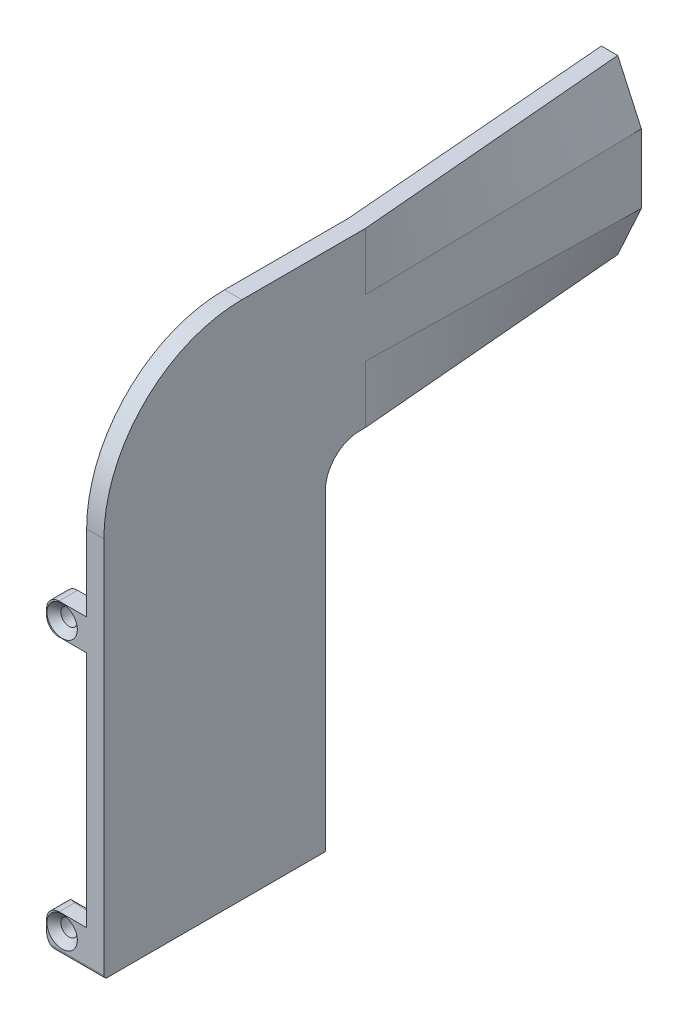
from build123d import *
from OCP.BRepFilletAPI import BRepFilletAPI_MakeFillet

# Parameters (mm, degrees)
BOSS_EXTRUDE1_START                                 = 0.25
SKETCH1_W                                           = 2.7
SKETCH1_H                                           = 4.5
BOSS_EXTRUDE1_DEPTH                                 = 5.8
SKETCH1_H_2                                         = 5.25
BOSS_EXTRUDE1_2_DEPTH                               = 5.8
BOSS_EXTRUDE1_3_DEPTH                               = 5.8
BOSS_EXTRUDE1_4_DEPTH                               = 5.8
SKETCH2_W                                           = 32.1
SKETCH2_H                                           = 44.25
BOSS_EXTRUDE2_DEPTH                                 = 2.5
BOSS_EXTRUDE3_DEPTH                                 = 2.5
CSK_FOR_M2_COUNTERSUNK_FLAT_HEAD_SCREW1_D           = 2.4
CSK_FOR_M2_COUNTERSUNK_FLAT_HEAD_SCREW1_DEPTH       = 4
CSK_FOR_M2_COUNTERSUNK_FLAT_HEAD_SCREW1_CSINK_D     = 4.4
CSK_FOR_M2_COUNTERSUNK_FLAT_HEAD_SCREW1_CSINK_ANGLE = 90
CSK_FOR_M2_COUNTERSUNK_FLAT_HEAD_SCREW1_TIP         = 0.721032743
CSK_FOR_M2_COUNTERSUNK_FLAT_HEAD_SCREW2_D           = 2.4
CSK_FOR_M2_COUNTERSUNK_FLAT_HEAD_SCREW2_DEPTH       = 4
CSK_FOR_M2_COUNTERSUNK_FLAT_HEAD_SCREW2_CSINK_D     = 4.4
CSK_FOR_M2_COUNTERSUNK_FLAT_HEAD_SCREW2_CSINK_ANGLE = 90
CSK_FOR_M2_COUNTERSUNK_FLAT_HEAD_SCREW2_TIP         = 0.721032743
FILLET1_R1                                          = 20
FILLET1_R2                                          = 5
FILLET2_R                                           = 1.8
FILLET3_R                                           = 0.5


with BuildPart() as part:
    # Sketch1 → Boss-Extrude1 (new body)
    with BuildSketch(Plane(origin=(30.600472417, 0, 0), x_dir=(0, 0, -1), z_dir=(1, 0, 0)).offset(BOSS_EXTRUDE1_START)):
        with Locations((-30.576835801, 55.903969126)):
            Rectangle(SKETCH1_W, SKETCH1_H)
    extrude(amount=BOSS_EXTRUDE1_DEPTH)



with BuildPart() as body_2:
    # Sketch1 → Boss-Extrude1 2 (new body)
    with BuildSketch(Plane(origin=(30.600472417, 0, 0), x_dir=(0, 0, -1), z_dir=(1, 0, 0)).offset(BOSS_EXTRUDE1_START)):
        with Locations((-30.576835801, 16.528969126)):
            Rectangle(SKETCH1_W, SKETCH1_H_2)
    extrude(amount=BOSS_EXTRUDE1_2_DEPTH)


with BuildPart() as body_3:
    # Sketch1 → Boss-Extrude1 3 (new body)
    with BuildSketch(Plane(origin=(30.600472417, 0, 0), x_dir=(0, 0, -1), z_dir=(1, 0, 0)).offset(BOSS_EXTRUDE1_START)):
        with Locations((-56.976835801, 16.528969126)):
            Rectangle(SKETCH1_W, SKETCH1_H_2)
    extrude(amount=BOSS_EXTRUDE1_3_DEPTH)


with BuildPart() as body_4:
    # Sketch1 → Boss-Extrude1 4 (new body)
    with BuildSketch(Plane(origin=(30.600472417, 0, 0), x_dir=(0, 0, -1), z_dir=(1, 0, 0)).offset(BOSS_EXTRUDE1_START)):
        with Locations((-56.976835801, 55.903969126)):
            Rectangle(SKETCH1_W, SKETCH1_H)
    extrude(amount=BOSS_EXTRUDE1_4_DEPTH)


with BuildPart() as part_1:
    add(part.part)

    add(body_2.part)  # Boss-Extrude2 merges body 2

    add(body_3.part)  # Boss-Extrude2 merges body 3

    add(body_4.part)  # Boss-Extrude2 merges body 4
    # Sketch2 → Boss-Extrude2 (add)
    with BuildSketch(Plane(origin=(36.650472417, 0, 0), x_dir=(0, 0, -1), z_dir=(1, 0, 0))):
        with Locations((-42.276835801, 36.028969126)):
            Rectangle(SKETCH2_W, SKETCH2_H)
    extrude(amount=BOSS_EXTRUDE2_DEPTH)

    # Sketch3 → Boss-Extrude3 (add)
    with BuildSketch(Plane(origin=(39.150472417, 0, 0), x_dir=(0, 0, -1), z_dir=(1, 0, 0))):
        Polygon((-20.426835801, 89.232146542), (-58.326835801, 89.232146542), (-58.326835801, 58.153969126), (-26.226835801, 58.153969126), (-26.226835801, 64.232146542), (-20.426835801, 64.232146542), align=None)
    extrude(amount=-BOSS_EXTRUDE3_DEPTH)

    # CSK for M2 Countersunk Flat Head Screw1
    with Locations(Plane.XY.offset(58.326835801)):
        with Locations((33.100472417, 55.903969126), (33.100472417, 16.903969126)):
            CounterSinkHole(CSK_FOR_M2_COUNTERSUNK_FLAT_HEAD_SCREW1_D / 2, CSK_FOR_M2_COUNTERSUNK_FLAT_HEAD_SCREW1_CSINK_D / 2, depth=CSK_FOR_M2_COUNTERSUNK_FLAT_HEAD_SCREW1_DEPTH, counter_sink_angle=CSK_FOR_M2_COUNTERSUNK_FLAT_HEAD_SCREW1_CSINK_ANGLE)
            with Locations((0, 0, -(CSK_FOR_M2_COUNTERSUNK_FLAT_HEAD_SCREW1_DEPTH + CSK_FOR_M2_COUNTERSUNK_FLAT_HEAD_SCREW1_TIP / 2))):  # 118° drill point
                Cone(0, CSK_FOR_M2_COUNTERSUNK_FLAT_HEAD_SCREW1_D / 2, CSK_FOR_M2_COUNTERSUNK_FLAT_HEAD_SCREW1_TIP, mode=Mode.SUBTRACT)

    # CSK for M2 Countersunk Flat Head Screw2
    with Locations(Plane(origin=(0, 0, 29.226835801), x_dir=(-1, 0, 0), z_dir=(0, 0, -1))):
        with Locations((-33.100472417, 55.903969126), (-33.100472417, 16.903969126)):
            CounterSinkHole(CSK_FOR_M2_COUNTERSUNK_FLAT_HEAD_SCREW2_D / 2, CSK_FOR_M2_COUNTERSUNK_FLAT_HEAD_SCREW2_CSINK_D / 2, depth=CSK_FOR_M2_COUNTERSUNK_FLAT_HEAD_SCREW2_DEPTH, counter_sink_angle=CSK_FOR_M2_COUNTERSUNK_FLAT_HEAD_SCREW2_CSINK_ANGLE)
            with Locations((0, 0, -(CSK_FOR_M2_COUNTERSUNK_FLAT_HEAD_SCREW2_DEPTH + CSK_FOR_M2_COUNTERSUNK_FLAT_HEAD_SCREW2_TIP / 2))):  # 118° drill point
                Cone(0, CSK_FOR_M2_COUNTERSUNK_FLAT_HEAD_SCREW2_D / 2, CSK_FOR_M2_COUNTERSUNK_FLAT_HEAD_SCREW2_TIP, mode=Mode.SUBTRACT)

    # Fillet1: one fillet with a radius per group of edges: ONE call of the kernel's fillet builder (fillet() takes one radius for all edges)
    fillet1_edges_1 = [part_1.edges().sort_by_distance(p)[0] for p in [
        (37.900472417, 89.232146542, 58.326835801),
    ]]
    fillet1_edges_2 = [part_1.edges().sort_by_distance(p)[0] for p in [
        (37.900472417, 64.232146542, 26.226835801),
    ]]
    fillet1 = BRepFilletAPI_MakeFillet(part_1.part.solid().wrapped)
    for e in fillet1_edges_1:
        fillet1.Add(FILLET1_R1, e.wrapped)
    for e in fillet1_edges_2:
        fillet1.Add(FILLET1_R2, e.wrapped)
    add(Compound.cast(fillet1.Shape()), mode=Mode.REPLACE)

    # Loft1: read off the stored shape, not the designer's step
    # Loft1: loft between two sections, ruled curve by curve
    loft1_from = [
        Edge.make_bspline([(39.150472417, 81.726792839, -19.573164199), (38.579023668, 82.977685123, -19.573164199), (38.007574919, 84.228577407, -19.573164199), (36.864677421, 86.730361975, -19.573164199), (36.293228672, 87.981254258, -19.573164199), (35.721779923, 89.232146542, -19.573164199)], [0, 0, 0, 0, 0.5, 0.5, 1, 1, 1, 1], 3),
        Edge.make_bspline([(33.358759351, 89.232146542, -19.573164199), (33.990711529, 87.848813209, -19.573164199), (34.622663707, 86.465479876, -19.573164199), (35.886568062, 83.698813209, -19.573164199), (36.51852024, 82.315479876, -19.573164199), (37.150472417, 80.932146542, -19.573164199)], [0, 0, 0, 0, 0.5, 0.5, 1, 1, 1, 1], 3),
        Edge.make_bspline([(37.150472417, 72.532146542, -19.573164199), (36.51852024, 71.148813209, -19.573164199), (35.886568062, 69.765479876, -19.573164199), (34.622663707, 66.998813209, -19.573164199), (33.990711529, 65.615479876, -19.573164199), (33.358759351, 64.232146542, -19.573164199)], [0, 0, 0, 0, 0.5, 0.5, 1, 1, 1, 1], 3),
        Edge.make_bspline([(35.721779923, 64.232146542, -19.573164199), (36.293228672, 65.483038826, -19.573164199), (36.864677421, 66.73393111, -19.573164199), (38.007574919, 69.235715678, -19.573164199), (38.579023668, 70.486607962, -19.573164199), (39.150472417, 71.737500246, -19.573164199)], [0, 0, 0, 0, 0.5, 0.5, 1, 1, 1, 1], 3),
        Edge.make_line((37.150472417, 72.532146542, -19.573164199), (37.150472417, 80.932146542, -19.573164199)),
        Edge.make_line((33.358759351, 89.232146542, -19.573164199), (35.721779923, 89.232146542, -19.573164199)),
        Edge.make_line((35.721779923, 64.232146542, -19.573164199), (33.358759351, 64.232146542, -19.573164199)),
        Edge.make_line((39.150472417, 71.737500246, -19.573164199), (39.150472417, 81.726792839, -19.573164199)),
    ]
    loft1_to = [
        Edge.make_bspline([(39.150472417, 80.898813209, 20.426835801), (39.150472417, 82.287702098, 20.426835801), (39.150472417, 83.676590987, 20.426835801), (39.150472417, 86.454368765, 20.426835801), (39.150472417, 87.843257653, 20.426835801), (39.150472417, 89.232146542, 20.426835801)], [0, 0, 0, 0, 0.5, 0.5, 1, 1, 1, 1], 3),
        Edge.make_bspline([(36.650472417, 89.232146542, 20.426835801), (36.650472417, 87.843257653, 20.426835801), (36.650472417, 86.454368765, 20.426835801), (36.650472417, 83.676590987, 20.426835801), (36.650472417, 82.287702098, 20.426835801), (36.650472417, 80.898813209, 20.426835801)], [0, 0, 0, 0, 0.5, 0.5, 1, 1, 1, 1], 3),
        Edge.make_bspline([(36.650472417, 72.565479876, 20.426835801), (36.650472417, 71.176590987, 20.426835801), (36.650472417, 69.787702098, 20.426835801), (36.650472417, 67.00992432, 20.426835801), (36.650472417, 65.621035431, 20.426835801), (36.650472417, 64.232146542, 20.426835801)], [0, 0, 0, 0, 0.5, 0.5, 1, 1, 1, 1], 3),
        Edge.make_bspline([(39.150472417, 64.232146542, 20.426835801), (39.150472417, 65.621035431, 20.426835801), (39.150472417, 67.00992432, 20.426835801), (39.150472417, 69.787702098, 20.426835801), (39.150472417, 71.176590987, 20.426835801), (39.150472417, 72.565479876, 20.426835801)], [0, 0, 0, 0, 0.5, 0.5, 1, 1, 1, 1], 3),
        Edge.make_line((36.650472417, 72.565479876, 20.426835801), (36.650472417, 80.898813209, 20.426835801)),
        Edge.make_line((36.650472417, 89.232146542, 20.426835801), (39.150472417, 89.232146542, 20.426835801)),
        Edge.make_line((39.150472417, 64.232146542, 20.426835801), (36.650472417, 64.232146542, 20.426835801)),
        Edge.make_line((39.150472417, 72.565479876, 20.426835801), (39.150472417, 80.898813209, 20.426835801)),
    ]
    loft1 = Solid(Shell([*[Face.make_surface_from_curves(loft1_from[k], loft1_to[k]) for k in range(8)], Face(Wire(loft1_from)), Face(Wire(loft1_to))]))
    add(loft1)

    # Fillet2
    fillet2_edges = [part_1.edges().sort_by_distance(p)[0] for p in [
        (30.850472417, 58.153969126, 30.576835801),
        (30.850472417, 13.903969126, 30.576835801),
        (30.850472417, 53.653969126, 30.576835801),
        (30.850472417, 19.153969126, 30.576835801),
        (30.850472417, 19.153969126, 56.976835801),
        (30.850472417, 13.903969126, 56.976835801),
        (30.850472417, 58.153969126, 56.976835801),
        (30.850472417, 53.653969126, 56.976835801),
    ]]
    fillet(fillet2_edges, radius=FILLET2_R)

    # Fillet3
    # the kernel refuses this fillet: 0.5 mm, written as the material it takes off along each edge
    with BuildSketch(Plane(origin=(40.400472417, 13.903969126, 58.326835801), x_dir=(0, 1, 0), z_dir=(-1, 0, 0))) as fillet3_piece_1:
        with BuildLine():
            CenterArc((FILLET3_R, FILLET3_R), FILLET3_R, 180, 90)
            Line((0, FILLET3_R), (0, 0))
            Line((0, 0), (FILLET3_R, 0))
        make_face()
    extrude(amount=9, mode=Mode.SUBTRACT)
    with BuildSketch(Plane(origin=(31.400472417, 19.153969126, 31.926835801), x_dir=(0, -1, 0), z_dir=(1, 0, 0)), Plane(origin=(31.400472417, 19.153969126, 55.626835801), x_dir=(0, 0, 1), z_dir=(1, 0, 0)), Plane(origin=(31.400472417, 53.653969126, 31.926835801), x_dir=(0, 0, -1), z_dir=(1, 0, 0))) as fillet3_piece_2:
        with BuildLine():
            CenterArc((FILLET3_R, FILLET3_R), FILLET3_R, 180, 90)
            Line((0, FILLET3_R), (0, 0))
            Line((0, 0), (FILLET3_R, 0))
        make_face()
    extrude(amount=5.25, mode=Mode.SUBTRACT)
    with BuildSketch(Plane(origin=(31.400472417, 13.903969126, 29.226835801), x_dir=(0, 0, 1), z_dir=(1, 0, 0)), Plane(origin=(31.400472417, 53.653969126, 55.626835801), x_dir=(0, 0, 1), z_dir=(1, 0, 0))) as fillet3_piece_3:
        with BuildLine():
            CenterArc((FILLET3_R, -FILLET3_R), FILLET3_R, 90, 90)
            Line((0, -FILLET3_R), (0, 0))
            Line((0, 0), (FILLET3_R, 0))
        make_face()
    extrude(amount=5.25, mode=Mode.SUBTRACT)


solid = part_1.part
